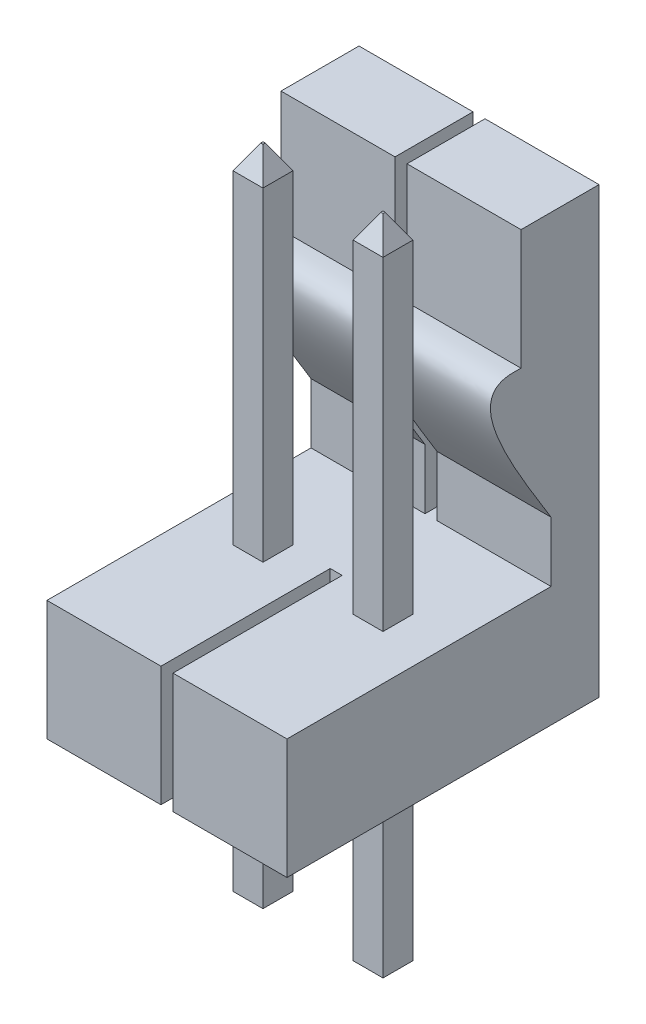
from build123d import *
from OCP.BRepFilletAPI import BRepFilletAPI_MakeChamfer

# Parameters (mm, degrees)
BASE_EXTRUDE_DEPTH        = 3.302
BASE_EXTRUDE_DEPTH_BACK   = 3.302
SKETCH3_W                 = 5.08
SKETCH3_H                 = 9.398
CUT_EXTRUDE1_START        = -5.08
CUT_EXTRUDE1_DEPTH        = 5.08
SKETCH5_W                 = 3.5814
SKETCH5_H                 = 2.54
CUT_EXTRUDE2_DEPTH        = 0.127
BOSS_EXTRUDE1_START       = -9.906
SKETCH6_W                 = 0.635
SKETCH6_H                 = 0.635
BOSS_EXTRUDE1_DEPTH       = 13.716
CHAMFER1_SIZE             = 0.508
CHAMFER1_SIZE2            = 0.293293937
CHAMFER1_OF_MIRROR1_SIZE  = 0.508
CHAMFER1_OF_MIRROR1_SIZE2 = 0.293293937


# Read off the part's stored shape, not the designer's step: Cut-Extrude1
with BuildPart() as part:
    # Sketch3 → Base-Extrude (new, two sides: drawn at the far end of the back side and taken through both)
    with BuildSketch(Plane.XY.offset(-BASE_EXTRUDE_DEPTH_BACK)):
        with Locations((1.27, 4.699)):
            Rectangle(SKETCH3_W, SKETCH3_H)
    extrude(amount=BASE_EXTRUDE_DEPTH + BASE_EXTRUDE_DEPTH_BACK)

    # Cut-Extrude1 outline → Cut-Extrude1 (cut)
    with BuildSketch(Plane.ZY.offset(1.27).offset(CUT_EXTRUDE1_START)):
        with BuildLine():
            add(Edge.make_bspline(
                [(-2.286, 3.81), (-1.368133743, 5.298530644), (-0.381370103, 6.898794196), (-1.568138006, 6.86066242), (-1.651, 6.858)],
                knots=[0, 0, 0, 0, 0.930178433, 1, 1, 1, 1], degree=3))
            Line((-2.286, 3.81), (-2.286, 2.54))
            Line((-2.286, 2.54), (3.302, 2.54))
            Line((3.302, 2.54), (3.302, 9.398))
            Line((3.302, 9.398), (-1.651, 9.398))
            Line((-1.651, 9.398), (-1.651, 6.858))
        make_face()
    extrude(amount=CUT_EXTRUDE1_DEPTH, mode=Mode.SUBTRACT)

    # Sketch5 → Cut-Extrude2 (cut, symmetric)
    with BuildSketch(Plane(origin=(1.27, 0, 0), x_dir=(0, 0, -1), z_dir=(1, 0, 0))):
        with Locations((-1.5113, 1.27)):
            Rectangle(SKETCH5_W, SKETCH5_H)
        with BuildLine():
            Line((3.302, 2.54), (3.302, 9.398))
            Line((3.302, 9.398), (1.651, 9.398))
            Line((1.651, 9.398), (1.651, 6.858))
            add(Edge.make_bspline(
                [(2.286, 3.81), (1.368133743, 5.298530644), (0.381370103, 6.898794196), (1.568138006, 6.86066242), (1.651, 6.858)],
                knots=[0, 0, 0, 0, 0.930178433, 1, 1, 1, 1], degree=3))
            Line((2.286, 3.81), (2.286, 2.54))
            Line((2.286, 2.54), (3.302, 2.54))
        make_face()
    extrude(amount=CUT_EXTRUDE2_DEPTH, both=True, mode=Mode.SUBTRACT)

    # Sketch6 → Boss-Extrude1 (add)
    with BuildSketch(Plane.XZ.offset(BOSS_EXTRUDE1_START)):
        Rectangle(SKETCH6_W, SKETCH6_H)
    boss_extrude1 = extrude(amount=BOSS_EXTRUDE1_DEPTH)

    # Chamfer1: one chamfer whose edges measure the first distance from different faces: ONE call of the kernel's chamfer builder (chamfer() names one face for all edges)
    chamfer1_edges_1 = [part.edges().sort_by_distance(p)[0] for p in [
        (-0.3175, 9.906, 0),
    ]]
    chamfer1_side_1 = [part.faces().sort_by_distance(p)[0] for p in [
        (-0.3175, 6.223, 0),
    ]]
    chamfer1_edges_2 = [part.edges().sort_by_distance(p)[0] for p in [
        (0, 9.906, -0.3175),
    ]]
    chamfer1_side_2 = [part.faces().sort_by_distance(p)[0] for p in [
        (0, 6.223, -0.3175),
    ]]
    chamfer1_edges_3 = [part.edges().sort_by_distance(p)[0] for p in [
        (0.3175, 9.906, 0),
    ]]
    chamfer1_side_3 = [part.faces().sort_by_distance(p)[0] for p in [
        (0.3175, 6.223, 0),
    ]]
    chamfer1_edges_4 = [part.edges().sort_by_distance(p)[0] for p in [
        (0, 9.906, 0.3175),
    ]]
    chamfer1_side_4 = [part.faces().sort_by_distance(p)[0] for p in [
        (0, 6.223, 0.3175),
    ]]
    chamfer1 = BRepFilletAPI_MakeChamfer(part.part.solid().wrapped)
    for e in chamfer1_edges_1:
        chamfer1.Add(CHAMFER1_SIZE, CHAMFER1_SIZE2, e.wrapped, chamfer1_side_1[0].wrapped)  # the first distance lies on this face
    for e in chamfer1_edges_2:
        chamfer1.Add(CHAMFER1_SIZE, CHAMFER1_SIZE2, e.wrapped, chamfer1_side_2[0].wrapped)  # the first distance lies on this face
    for e in chamfer1_edges_3:
        chamfer1.Add(CHAMFER1_SIZE, CHAMFER1_SIZE2, e.wrapped, chamfer1_side_3[0].wrapped)  # the first distance lies on this face
    for e in chamfer1_edges_4:
        chamfer1.Add(CHAMFER1_SIZE, CHAMFER1_SIZE2, e.wrapped, chamfer1_side_4[0].wrapped)  # the first distance lies on this face
    add(Compound.cast(chamfer1.Shape()), mode=Mode.REPLACE)

    # Mirror1: Boss-Extrude1 across plane
    add(boss_extrude1.mirror(Plane(origin=(1.27, 0, 0), x_dir=(0, 0, 1), z_dir=(1, 0, 0))))

    # Chamfer1 of Mirror1: one chamfer whose edges measure the first distance from different faces: ONE call of the kernel's chamfer builder (chamfer() names one face for all edges)
    chamfer1_of_mirror1_edges_1 = [part.edges().sort_by_distance(p)[0] for p in [
        (2.8575, 9.906, 0),
    ]]
    chamfer1_of_mirror1_side_1 = [part.faces().sort_by_distance(p)[0] for p in [
        (2.8575, 6.223, 0),
    ]]
    chamfer1_of_mirror1_edges_2 = [part.edges().sort_by_distance(p)[0] for p in [
        (2.54, 9.906, -0.3175),
    ]]
    chamfer1_of_mirror1_side_2 = [part.faces().sort_by_distance(p)[0] for p in [
        (2.54, 6.223, -0.3175),
    ]]
    chamfer1_of_mirror1_edges_3 = [part.edges().sort_by_distance(p)[0] for p in [
        (2.2225, 9.906, 0),
    ]]
    chamfer1_of_mirror1_side_3 = [part.faces().sort_by_distance(p)[0] for p in [
        (2.2225, 6.223, 0),
    ]]
    chamfer1_of_mirror1_edges_4 = [part.edges().sort_by_distance(p)[0] for p in [
        (2.54, 9.906, 0.3175),
    ]]
    chamfer1_of_mirror1_side_4 = [part.faces().sort_by_distance(p)[0] for p in [
        (2.54, 6.223, 0.3175),
    ]]
    chamfer1_of_mirror1 = BRepFilletAPI_MakeChamfer(part.part.solid().wrapped)
    for e in chamfer1_of_mirror1_edges_1:
        chamfer1_of_mirror1.Add(CHAMFER1_OF_MIRROR1_SIZE, CHAMFER1_OF_MIRROR1_SIZE2, e.wrapped, chamfer1_of_mirror1_side_1[0].wrapped)  # the first distance lies on this face
    for e in chamfer1_of_mirror1_edges_2:
        chamfer1_of_mirror1.Add(CHAMFER1_OF_MIRROR1_SIZE, CHAMFER1_OF_MIRROR1_SIZE2, e.wrapped, chamfer1_of_mirror1_side_2[0].wrapped)  # the first distance lies on this face
    for e in chamfer1_of_mirror1_edges_3:
        chamfer1_of_mirror1.Add(CHAMFER1_OF_MIRROR1_SIZE, CHAMFER1_OF_MIRROR1_SIZE2, e.wrapped, chamfer1_of_mirror1_side_3[0].wrapped)  # the first distance lies on this face
    for e in chamfer1_of_mirror1_edges_4:
        chamfer1_of_mirror1.Add(CHAMFER1_OF_MIRROR1_SIZE, CHAMFER1_OF_MIRROR1_SIZE2, e.wrapped, chamfer1_of_mirror1_side_4[0].wrapped)  # the first distance lies on this face
    add(Compound.cast(chamfer1_of_mirror1.Shape()), mode=Mode.REPLACE)


solid = part.part
